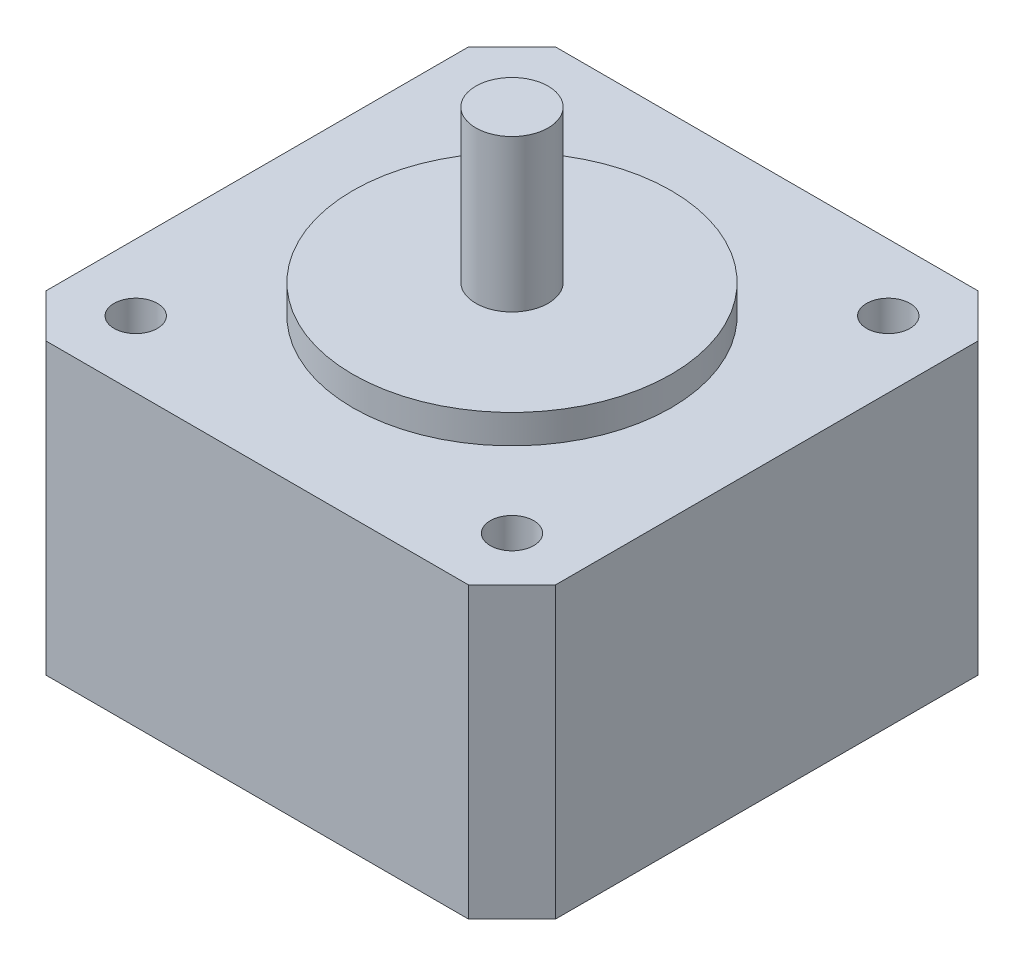
from build123d import *

# Parameters (mm, degrees)
SKETCH1_W           = 35.2
SKETCH1_H           = 35.2
BOSS_EXTRUDE1_DEPTH = 20
SKETCH2_R           = 11
BOSS_EXTRUDE2_DEPTH = 2
SKETCH3_R           = 2.5
BOSS_EXTRUDE3_DEPTH = 10.5
SKETCH4_R           = 1.5
CUT_EXTRUDE1_DEPTH  = 4.5
CHAMFER1_SIZE       = 3


with BuildPart() as part:
    # Sketch1 → Boss-Extrude1 (new body)
    with BuildSketch(Plane(origin=(0, 0, 0), x_dir=(1, 0, 0), z_dir=(0, 1, 0))):
        Rectangle(SKETCH1_W, SKETCH1_H)
    extrude(amount=BOSS_EXTRUDE1_DEPTH)

    # Sketch2 → Boss-Extrude2 (add)
    with BuildSketch(Plane(origin=(0, 20, 0), x_dir=(1, 0, 0), z_dir=(0, 1, 0))):
        Circle(SKETCH2_R)
    extrude(amount=BOSS_EXTRUDE2_DEPTH)

    # Sketch3 → Boss-Extrude3 (add)
    with BuildSketch(Plane(origin=(0, 22, 0), x_dir=(1, 0, 0), z_dir=(0, 1, 0))):
        Circle(SKETCH3_R)
    extrude(amount=BOSS_EXTRUDE3_DEPTH)

    # Sketch4 → Cut-Extrude1 (cut)
    with BuildSketch(Plane(origin=(0, 20, 0), x_dir=(1, 0, 0), z_dir=(0, 1, 0))):
        with Locations((-13, 13)):
            Circle(SKETCH4_R)
        with Locations((13, 13)):
            Circle(SKETCH4_R)
        with Locations((13, -13)):
            Circle(SKETCH4_R)
        with Locations((-13, -13)):
            Circle(SKETCH4_R)
    extrude(amount=-CUT_EXTRUDE1_DEPTH, mode=Mode.SUBTRACT)

    # Chamfer1
    chamfer1_edges = [part.edges().sort_by_distance(p)[0] for p in [
        (-17.6, 10, 17.6),
        (-17.6, 10, -17.6),
        (17.6, 10, -17.6),
        (17.6, 10, 17.6),
    ]]
    chamfer(chamfer1_edges, length=CHAMFER1_SIZE)


solid = part.part
